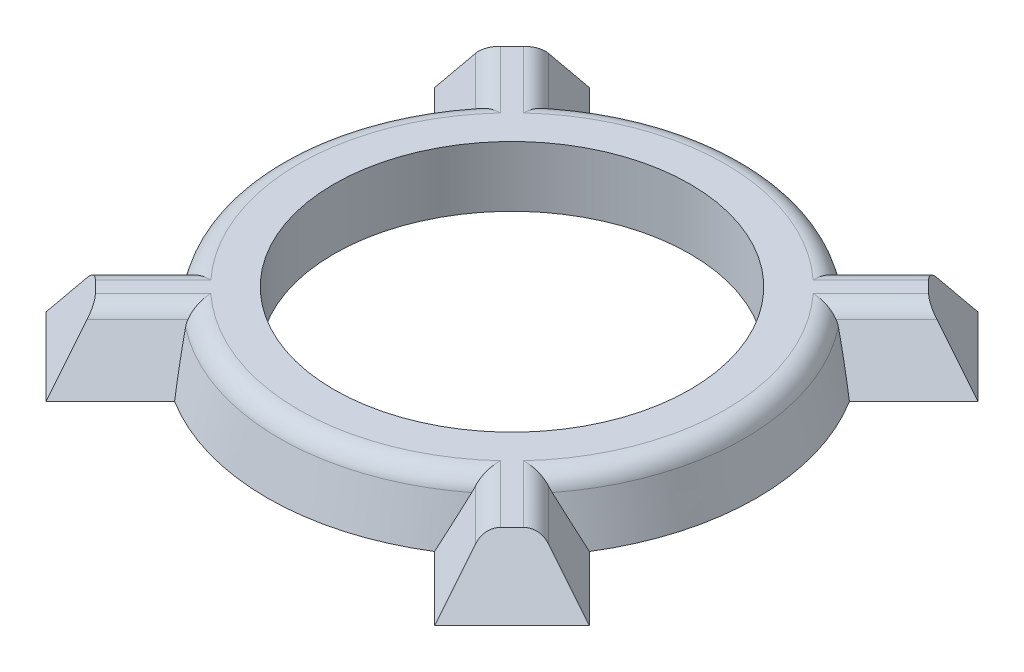
from build123d import *

# Parameters (mm, degrees)
SKETCH2_R           = 12.145554975
BOSS_EXTRUDE1_DEPTH = 3
BOSS_EXTRUDE1_TAPER = 15
BOSS_EXTRUDE2_DEPTH = 3
BOSS_EXTRUDE2_TAPER = 30
FILLET1_R           = 1
CIRPATTERN2_START   = -14.617361382
CIRPATTERN2_DEPTH   = 29.234722764
CIRPATTERN2_START_2 = -0.407249855
CIRPATTERN2_2_DEPTH = 0.81449971
CIRPATTERN2_START_3 = 2.716651032
CIRPATTERN2_3_DEPTH = 13.632761157
CIRPATTERN2_START_4 = -2.716651132
CIRPATTERN2_4_DEPTH = 5.433302164
CIRPATTERN2_START_5 = -11.369329343
CIRPATTERN2_5_DEPTH = 22.738655401
CIRPATTERN2_START_6 = -17
CIRPATTERN2_6_DEPTH = 2.382638618
CIRPATTERN2_START_7 = 14.617361382
CIRPATTERN2_7_DEPTH = 2.382638618
SKETCH4_R           = 8.834020379
CUT_EXTRUDE1_DEPTH  = 20.300641771


with BuildPart() as part:
    # Sketch2 → Boss-Extrude1 (new body)
    with BuildSketch(Plane(origin=(0, 0, 0), x_dir=(1, 0, 0), z_dir=(0, 1, 0))):
        Circle(SKETCH2_R)
    extrude(amount=BOSS_EXTRUDE1_DEPTH, taper=BOSS_EXTRUDE1_TAPER)

    # Sketch3 → Boss-Extrude2 (add)
    with BuildSketch(Plane(origin=(0, 0, 0), x_dir=(1, 0, 0), z_dir=(0, 1, 0))):
        Polygon((-7.65848972, -3.816564986), (-13.481742595, -9.639817861), (-9.639817861, -13.481742595), (-3.816564986, -7.65848972), align=None)
    extrude(amount=BOSS_EXTRUDE2_DEPTH, taper=BOSS_EXTRUDE2_TAPER)

    # Fillet1
    fillet1_edges = [part.edges().sort_by_distance(p)[0] for p in [
        (-8.466560643, 3, 9.858995634),
        (-9.858995634, 3, 8.466560643),
        (-3.880929208, 3, -10.657050022),
    ]]
    fillet(fillet1_edges, radius=FILLET1_R)

    # CirPattern2: read off the stored shape, not the designer's step
    # CirPattern2 outline → CirPattern2 (add)
    with BuildSketch(Plane(origin=(0, 0, 0), x_dir=(0.707106781186545, 0, -0.70710678118655), z_dir=(0.70710678118655, 0, 0.707106781186545)).offset(CIRPATTERN2_START)):
        with BuildLine():
            ThreePointArc((1.273275359, 2.5), (0.907249955, 2.866025404), (0.407249955, 3))
            Line((0.407249955, 3), (-0.407249955, 3))
            ThreePointArc((-0.407249955, 3), (-0.907249955, 2.866025404), (-1.273275359, 2.5))
            Line((-1.273275359, 2.5), (-2.716651032, 0))
            Line((-2.716651032, 0), (2.716651032, 0))
            Line((2.716651032, 0), (1.273275359, 2.5))
        make_face()
    extrude(amount=CIRPATTERN2_DEPTH)

    # CirPattern2 2 outline → CirPattern2 2 (add)
    with BuildSketch(Plane(origin=(0, 0, 0), x_dir=(0.707106781186545, 0, -0.70710678118655), z_dir=(0.70710678118655, 0, 0.707106781186545)).offset(CIRPATTERN2_START_2)):
        with BuildLine():
            Line((16.349412189, 0), (14.617361382, 3))
            Line((14.617361382, 3), (0.407249955, 3))
            ThreePointArc((0.407249955, 3), (0.907249955, 2.866025404), (1.273275359, 2.5))
            Line((1.273275359, 2.5), (2.716651032, 0))
            Line((2.716651032, 0), (16.349412189, 0))
        make_face()
    extrude(amount=CIRPATTERN2_2_DEPTH)

    # CirPattern2 3 outline → CirPattern2 3 (add)
    with BuildSketch(Plane(origin=(0, 0, 0), x_dir=(0.707106781186548, 0, 0.707106781186547), z_dir=(0.707106781186547, 0, -0.707106781186548)).offset(CIRPATTERN2_START_3)):
        with BuildLine():
            Line((2.716651032, 0), (0.407249855, 0))
            Line((0.407249855, 0), (0.407249955, -3))
            ThreePointArc((0.407249955, -3), (0.907249955, -2.866025404), (1.273275359, -2.5))
            Line((1.273275359, -2.5), (2.716651032, 0))
        make_face()
        with BuildLine():
            Line((-0.407249855, 0), (-2.716651032, 0))
            Line((-2.716651032, 0), (-1.273275359, -2.5))
            ThreePointArc((-1.273275359, -2.5), (-0.907249955, -2.866025404), (-0.407249955, -3))
            Line((-0.407249955, -3), (-0.407249855, 0))
        make_face()
    extrude(amount=CIRPATTERN2_3_DEPTH)

    # CirPattern2 4 outline → CirPattern2 4 (add)
    with BuildSketch(Plane(origin=(0, 0, 0), x_dir=(0.707106781186548, 0, 0.707106781186547), z_dir=(0.707106781186547, 0, -0.707106781186548)).offset(CIRPATTERN2_START_4)):
        Polygon((16.349412189, 0), (14.617361382, 0), (14.617361382, -3), align=None)
        Polygon((-14.617361382, 0), (-16.349412189, 0), (-14.617361382, -3), align=None)
    extrude(amount=CIRPATTERN2_4_DEPTH)

    # CirPattern2 5 outline → CirPattern2 5 (cut)
    with BuildSketch(Plane(origin=(0, 0, 0), x_dir=(0.7071067811865451, 0, -0.7071067811865499), z_dir=(0.7071067811865498, 0, 0.7071067811865454)).offset(CIRPATTERN2_START_5)):
        Polygon((14.617361382, 3), (16.349412189, 0), (16.349412189, 3), align=None)
    extrude(amount=CIRPATTERN2_5_DEPTH, mode=Mode.SUBTRACT)

    # CirPattern2 6 outline → CirPattern2 6 (cut)
    with BuildSketch(Plane(origin=(0, 0, 0), x_dir=(0.7071067811865451, 0, -0.7071067811865499), z_dir=(0.7071067811865498, 0, 0.7071067811865454)).offset(CIRPATTERN2_START_6)):
        with BuildLine():
            Line((-0.407249955, 3), (-2.716651132, 3))
            Line((-2.716651132, 3), (-2.716651132, 0))
            Line((-2.716651132, 0), (-1.273275359, 2.5))
            ThreePointArc((-1.273275359, 2.5), (-0.907249955, 2.866025404), (-0.407249955, 3))
        make_face()
        with BuildLine():
            Line((2.716651032, 3), (0.407249955, 3))
            ThreePointArc((0.407249955, 3), (0.907249955, 2.866025404), (1.273275359, 2.5))
            Line((1.273275359, 2.5), (2.716651032, 0))
            Line((2.716651032, 0), (2.716651032, 3))
        make_face()
    extrude(amount=CIRPATTERN2_6_DEPTH, mode=Mode.SUBTRACT)

    # CirPattern2 7 outline → CirPattern2 7 (cut)
    with BuildSketch(Plane(origin=(0, 0, 0), x_dir=(0.7071067811865451, 0, -0.7071067811865499), z_dir=(0.7071067811865498, 0, 0.7071067811865454)).offset(CIRPATTERN2_START_7)):
        with BuildLine():
            Line((-0.407249955, 3), (-2.716651132, 3))
            Line((-2.716651132, 3), (-2.716651132, 0))
            Line((-2.716651132, 0), (-1.273275359, 2.5))
            ThreePointArc((-1.273275359, 2.5), (-0.907249955, 2.866025404), (-0.407249955, 3))
        make_face()
        with BuildLine():
            Line((2.716651032, 3), (0.407249955, 3))
            ThreePointArc((0.407249955, 3), (0.907249955, 2.866025404), (1.273275359, 2.5))
            Line((1.273275359, 2.5), (2.716651032, 0))
            Line((2.716651032, 0), (2.716651032, 3))
        make_face()
    extrude(amount=CIRPATTERN2_7_DEPTH, mode=Mode.SUBTRACT)

    # Sketch4 → Cut-Extrude1 (cut, through all)
    with BuildSketch(Plane(origin=(0, 3, 0), x_dir=(1, 0, 0), z_dir=(0, 1, 0))):
        with Locations(Location((0, 0, 0), (0, 0, 270))):
            Circle(SKETCH4_R)
    extrude(amount=-CUT_EXTRUDE1_DEPTH, mode=Mode.SUBTRACT)


solid = part.part
